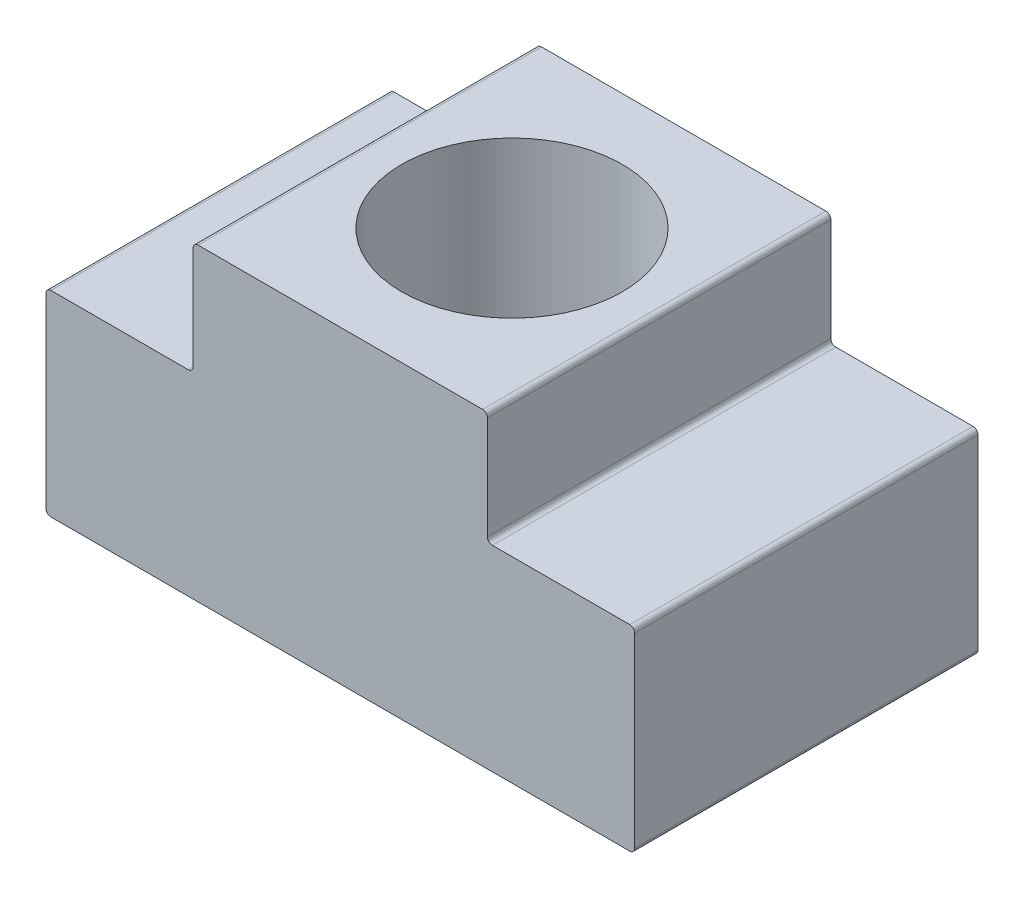
from build123d import *

# Parameters (mm, degrees)
BOSS_EXTRUDE1_DEPTH = 7
SKETCH2_R           = 2.25
CUT_EXTRUDE1_DEPTH  = 7
FILLET1_R           = 0.1


with BuildPart() as part:
    # Sketch1 → Boss-Extrude1 (new body)
    with BuildSketch(Plane.XY):
        Polygon((0, 6.3), (3, 6.3), (3, 4), (6, 4), (6, 0), (0, 0), align=None)
    boss_extrude1 = extrude(amount=BOSS_EXTRUDE1_DEPTH)

    # Mirror1: Boss-Extrude1 across plane
    add(boss_extrude1.mirror(Plane(origin=(0, 0, 0), x_dir=(0, 0, 1), z_dir=(1, 0, 0))))

    # Sketch2 → Cut-Extrude1 (cut)
    with BuildSketch(Plane(origin=(0, 6.3, 0), x_dir=(1, 0, 0), z_dir=(0, 1, 0))):
        with Locations((0, -3.5)):
            Circle(SKETCH2_R)
    extrude(amount=-CUT_EXTRUDE1_DEPTH, mode=Mode.SUBTRACT)

    # Fillet1
    fillet1_edges = [part.edges().sort_by_distance(p)[0] for p in [
        (3, 4, 3.5),
        (6, 0, 3.5),
        (6, 4, 3.5),
        (-3, 6.3, 3.5),
        (3, 6.3, 3.5),
        (-6, 0, 3.5),
        (-6, 4, 3.5),
        (-3, 4, 3.5),
    ]]
    fillet(fillet1_edges, radius=FILLET1_R)


solid = part.part
